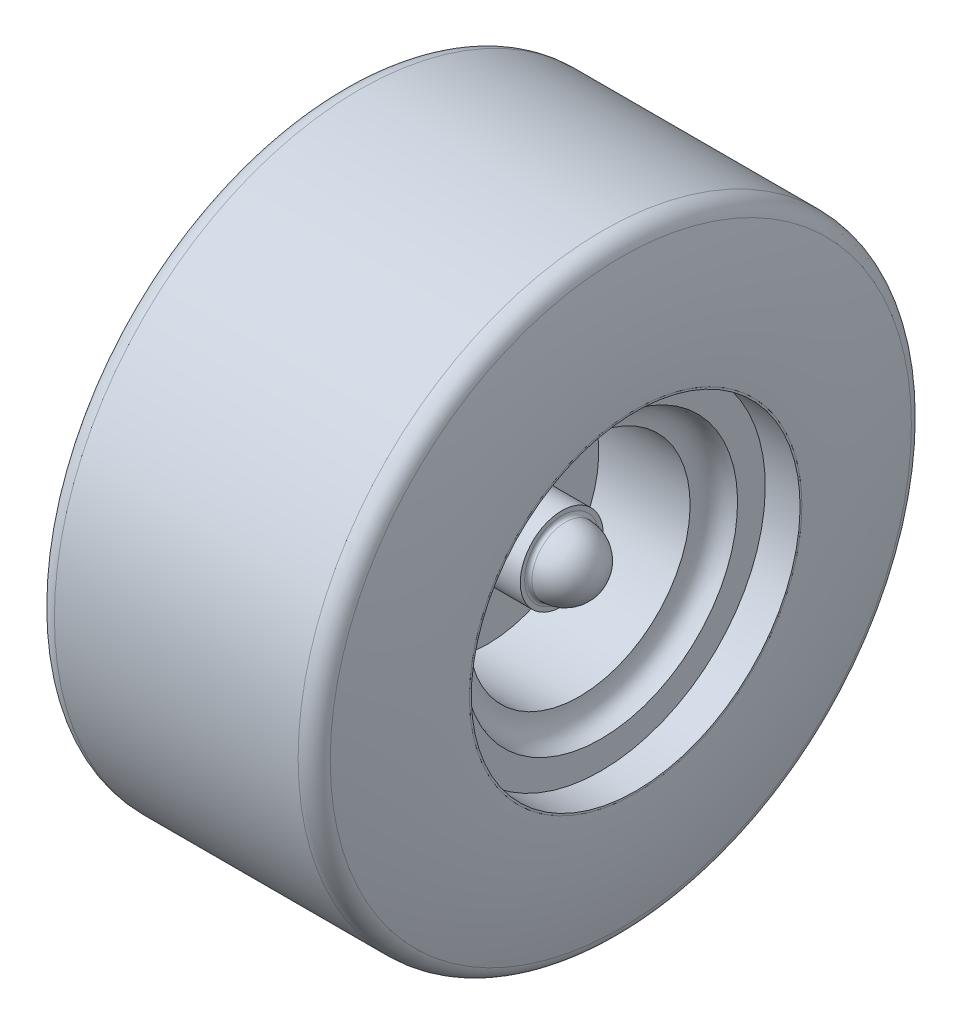
from build123d import *

# Parameters (mm, degrees)
SKETCH4_R           = 28.575
BOSS_EXTRUDE2_DEPTH = 50.8
SKETCH6_R           = 23.024747335
BOSS_EXTRUDE5_DEPTH = 2.54
DOME1_FACE_RADIUS   = 23.024747335
DOME1_HEIGHT        = 22.86
FILLET1_R           = 2.54
SKETCH5_R           = 19.05
BOSS_EXTRUDE3_DEPTH = 63.5
FILLET2_R           = 12.7


with BuildPart() as part:
    # Sketch1 → Revolve1 (revolve)
    with BuildSketch(Plane.XY, mode=Mode.PRIVATE) as revolve1_sk:
        with BuildLine():
            Line((0, 209.55), (93.6625, 209.55))
            add(Edge.make_bspline(
                [(93.6625, 209.55), (106.3625, 162.346468393), (106.3625, 114.3)],
                knots=[0, 0, 0, 1, 1, 1], degree=2))
            Line((106.3625, 114.3), (0, 114.3))
            Line((0, 114.3), (0, 209.55))
        make_face()
    revolve1 = revolve(revolve1_sk.sketch.rotate(Axis((0, 0, 0), (1, 0, 0)), 90), axis=Axis((0, 0, 0), (1, 0, 0)))

    # Mirror1: Revolve1 across Right Plane
    add(revolve1.mirror(Plane(origin=(0, 0, 0), x_dir=(0, 0, -1), z_dir=(1, 0, 0))))

    # Fillet2
    fillet2_edges = [part.edges().sort_by_distance(p)[0] for p in [
        (-93.6625, 0, -209.55),
        (93.6625, 0, -209.55),
    ]]
    fillet(fillet2_edges, radius=FILLET2_R)


with BuildPart() as body_2:
    # Sketch2 → Revolve2 (revolve)
    with BuildSketch(Plane.XY, mode=Mode.PRIVATE) as revolve2_sk:
        Polygon((-17.4625, 0), (-17.4625, 96.915183097), (-90.247683097, 96.915183097), (-101.760694514, 113.03), (-106.3625, 113.03), (-106.3625, 114.3), (0, 114.3), (0, 0), align=None)
    revolve(revolve2_sk.sketch.rotate(Axis((0, 0, 0), (-1, 0, 0)), 90), axis=Axis((0, 0, 0), (-1, 0, 0)))

    # Sketch3 → Revolve3 (revolve)
    with BuildSketch(Plane.XY, mode=Mode.PRIVATE) as revolve3_sk:
        with BuildLine():
            Line((106.3625, 114.3), (0, 114.3))
            Line((0, 114.3), (0, 0))
            Line((0, 0), (4.7625, 0))
            Line((4.7625, 0), (4.7625, 76.2))
            Line((4.7625, 76.2), (67.583190848, 76.2))
            add(Edge.make_bspline(
                [(67.583190848, 76.2), (67.397414566, 92.789135053), (82.439526037, 93.98)],
                knots=[0, 0, 0, 1, 1, 1], degree=2))
            Line((82.439526037, 93.98), (82.439526037, 113.03))
            Line((82.439526037, 113.03), (106.3625, 113.03))
            Line((106.3625, 113.03), (106.3625, 114.3))
        make_face()
    revolve(revolve3_sk.sketch.rotate(Axis((4.7625, 0, 0), (1, 0, 0)), 180), axis=Axis((4.7625, 0, 0), (1, 0, 0)))


with BuildPart() as body_3:
    # Sketch4 → Boss-Extrude2 (new body)
    with BuildSketch(Plane(origin=(4.7625, 0, 0), x_dir=(0, 0, -1), z_dir=(1, 0, 0))):
        with Locations(Location((0, 0, 0), (0, 0, 90))):
            Circle(SKETCH4_R)
    extrude(amount=BOSS_EXTRUDE2_DEPTH)

    # Sketch6 → Boss-Extrude5 (add)
    with BuildSketch(Plane(origin=(55.5625, 0, 0), x_dir=(0, 0, -1), z_dir=(1, 0, 0))):
        with Locations(Location((0, 0, 0), (0, 0, 90))):
            Circle(SKETCH6_R)
    extrude(amount=BOSS_EXTRUDE5_DEPTH)

    # Dome1: a dome of height H over a round flat face of radius A is a cap of a sphere of radius (A * A + H * H) / (2 * H)
    dome1_r = (DOME1_FACE_RADIUS * DOME1_FACE_RADIUS + DOME1_HEIGHT * DOME1_HEIGHT) / (2 * DOME1_HEIGHT)
    dome1_base = Plane((58.1025, 0, 0), z_dir=(1, 0, 0))
    with Locations(dome1_base.offset(DOME1_HEIGHT - dome1_r)):
        dome1_ball = Sphere(dome1_r, mode=Mode.PRIVATE)
    add(split(dome1_ball, bisect_by=dome1_base, keep=Keep.TOP, mode=Mode.PRIVATE))

    # Fillet1
    fillet1_edges = [body_3.edges().sort_by_distance(p)[0] for p in [
        (55.5625, -23.024747335, 0),
    ]]
    fillet(fillet1_edges, radius=FILLET1_R - 0.0001)  # a hair under: the kernel refuses the full size


with BuildPart() as body_4:
    # Sketch5 → Boss-Extrude3 (new body)
    with BuildSketch(Plane.ZY.offset(17.4625)):
        Circle(SKETCH5_R)
    extrude(amount=BOSS_EXTRUDE3_DEPTH)


solid = Compound([part.part, body_2.part, body_3.part, body_4.part])
